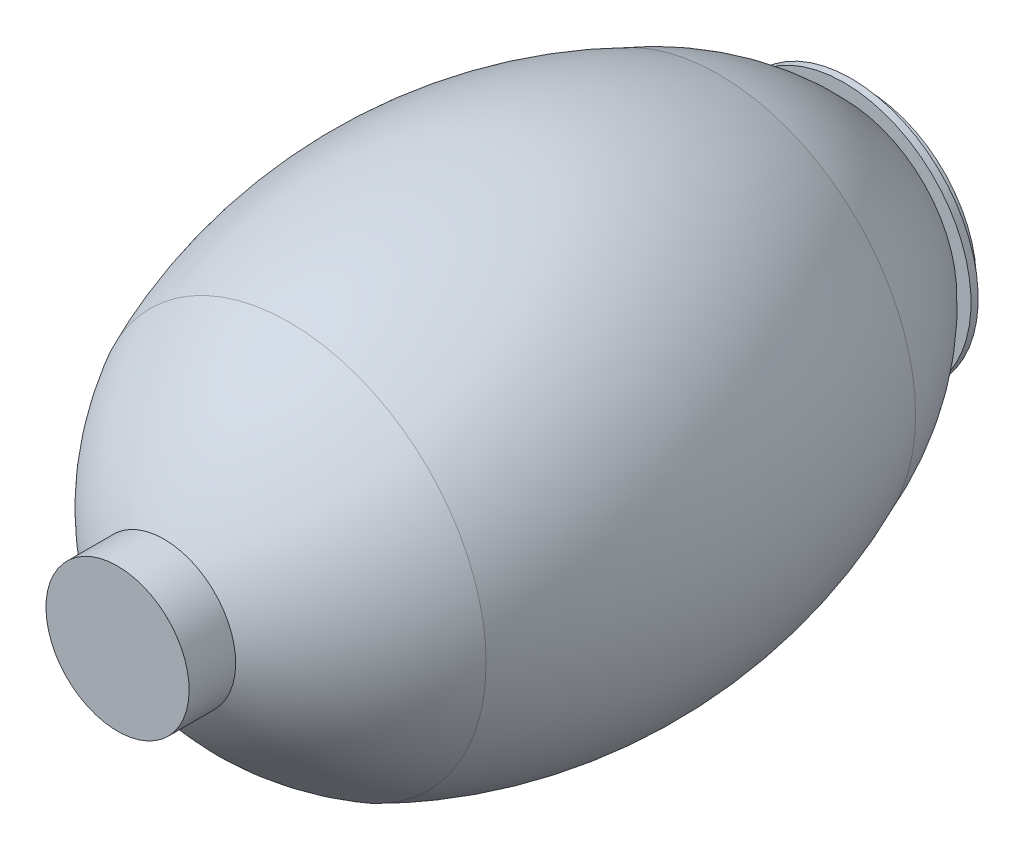
from build123d import *


with BuildPart() as part:
    # Sketch1 → Revolve1 (revolve)
    with BuildSketch(Plane(origin=(0, 0, 0), x_dir=(0, 0, -1), z_dir=(1, 0, 0))):
        with BuildLine():
            Line((0, 20), (0, 0))
            Line((0, 0), (209, 0))
            Line((209, 0), (209, 31))
            Line((209, 31), (205, 31))
            Line((205, 31), (205, 35.5))
            Line((205, 35.5), (203, 35.5))
            Line((203, 35.5), (203, 31.5))
            ThreePointArc((203, 31.5), (186.895377255, 45.328221444), (168, 55))
            ThreePointArc((168, 55), (108, 67.5), (48, 55))
            ThreePointArc((48, 55), (28.046580946, 39.953419054), (13, 20))
            Line((13, 20), (0, 20))
        make_face()
    revolve(axis=Axis((0, 0, -209), (0, 0, 1)))


solid = part.part
